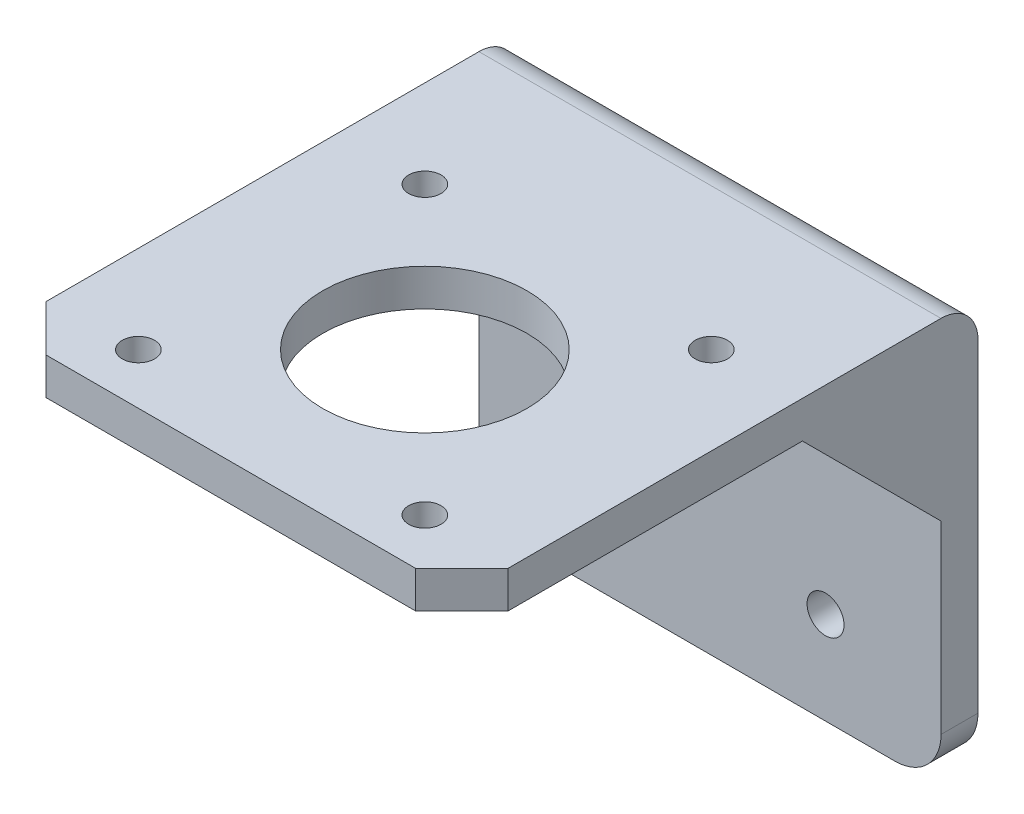
from build123d import *

# Parameters (mm, degrees)
SCHIZZO1_R                             = 1.75
SCHIZZO1_R_2                           = 11.05
SCHIZZO1_R_3                           = 2
BASE_FLANGIA1_DEPTH                    = 4
PIEGATURA_START                        = -3.5
PIEGATURA_DELLO_SCHIZZO1_OUTLINE_W     = 50
PIEGATURA_DELLO_SCHIZZO1_OUTLINE_H     = 4
PIEGATURA_DELLO_SCHIZZO1_DEPTH         = 51
PIEGATURA_START_2                      = -7.5
PIEGATURA_DELLO_SCHIZZO1_2_OUTLINE_R   = 1.75
PIEGATURA_DELLO_SCHIZZO1_2_OUTLINE_R_2 = 11.05
PIEGATURA_DELLO_SCHIZZO1_2_DEPTH       = 4
PIEGATURA_START_3                      = -26
PIEGATURA_DELLO_SCHIZZO1_3_DEPTH       = 52
PIEGATURA_START_4                      = -25
PIEGATURA_DELLO_SCHIZZO1_4_DEPTH       = 50
ESTRUSIONE_ESTRUSIONE1_DEPTH           = 2


with BuildPart() as part:
    # Base-Flangia1: sheet metal written as solids
    # Schizzo1 → Base-Flangia1 (new body)
    with BuildSketch(Plane.XY):
        with BuildLine():
            Line((-25, 42.5), (-20, 47.5))
            Line((-20, 47.5), (20, 47.5))
            Line((20, 47.5), (25, 42.5))
            Line((25, 42.5), (25, -42.5))
            ThreePointArc((25, -42.5), (23.535533906, -46.035533906), (20, -47.5))
            Line((20, -47.5), (-20, -47.5))
            ThreePointArc((-20, -47.5), (-23.535533906, -46.035533906), (-25, -42.5))
            Line((-25, -42.5), (-25, 42.5))
        make_face()
        with Locations((-15.5, 42)):
            Circle(SCHIZZO1_R, mode=Mode.SUBTRACT)
        with Locations((15.5, 42)):
            Circle(SCHIZZO1_R, mode=Mode.SUBTRACT)
        with Locations((15.5, 11)):
            Circle(SCHIZZO1_R, mode=Mode.SUBTRACT)
        with Locations((-15.5, 11)):
            Circle(SCHIZZO1_R, mode=Mode.SUBTRACT)
        with Locations((0, 26.5)):
            Circle(SCHIZZO1_R_2, mode=Mode.SUBTRACT)
        with Locations((-12.5, -37.5)):
            Circle(SCHIZZO1_R_3, mode=Mode.SUBTRACT)
        with Locations((12.5, -37.5)):
            Circle(SCHIZZO1_R_3, mode=Mode.SUBTRACT)
    extrude(amount=-BASE_FLANGIA1_DEPTH)

    # Piegatura dello schizzo1: read off the stored shape, not the designer's step
    # Piegatura dello schizzo1 outline → Piegatura dello schizzo1 (cut)
    with BuildSketch(Plane(origin=(0, 0, 0), x_dir=(1, 0, 0), z_dir=(0, 1, 0)).offset(PIEGATURA_START)):
        with Locations((0, 2)):
            Rectangle(PIEGATURA_DELLO_SCHIZZO1_OUTLINE_W, PIEGATURA_DELLO_SCHIZZO1_OUTLINE_H)
    extrude(amount=PIEGATURA_DELLO_SCHIZZO1_DEPTH, mode=Mode.SUBTRACT)

    # Piegatura dello schizzo1 2 outline → Piegatura dello schizzo1 2 (add)
    with BuildSketch(Plane(origin=(0, 0, 0), x_dir=(1, 0, 0), z_dir=(0, 1, 0)).offset(PIEGATURA_START_2)):
        Polygon((-25, 0), (-25, -46.862699383), (-20, -51.862699383), (20, -51.862699383), (25, -46.862699383), (25, 0), align=None)
        with Locations((-15.5, -46.362699383)):
            Circle(PIEGATURA_DELLO_SCHIZZO1_2_OUTLINE_R, mode=Mode.SUBTRACT)
        with Locations((15.5, -46.362699383)):
            Circle(PIEGATURA_DELLO_SCHIZZO1_2_OUTLINE_R, mode=Mode.SUBTRACT)
        with Locations((0, -30.862699383)):
            Circle(PIEGATURA_DELLO_SCHIZZO1_2_OUTLINE_R_2, mode=Mode.SUBTRACT)
        with Locations((-15.5, -15.362699383)):
            Circle(PIEGATURA_DELLO_SCHIZZO1_2_OUTLINE_R, mode=Mode.SUBTRACT)
        with Locations((15.5, -15.362699383)):
            Circle(PIEGATURA_DELLO_SCHIZZO1_2_OUTLINE_R, mode=Mode.SUBTRACT)
    extrude(amount=PIEGATURA_DELLO_SCHIZZO1_2_DEPTH)

    # Piegatura dello schizzo1 3 outline → Piegatura dello schizzo1 3 (cut)
    with BuildSketch(Plane.YZ.offset(PIEGATURA_START_3)):
        with BuildLine():
            ThreePointArc((-3.5, 0.01), (-4.674501807, -2.825498193), (-7.51, -4))
            Line((-7.51, -4), (-3.5, -4))
            Line((-3.5, -4), (-3.5, 0.01))
        make_face()
    extrude(amount=PIEGATURA_DELLO_SCHIZZO1_3_DEPTH, mode=Mode.SUBTRACT)

    # Piegatura dello schizzo1 4 outline → Piegatura dello schizzo1 4 (add)
    with BuildSketch(Plane.YZ.offset(PIEGATURA_START_4)):
        with BuildLine():
            ThreePointArc((-7.5, 0.01), (-7.502928932, 0.002928932), (-7.51, 0))
            Line((-7.51, 0), (-7.5, 0))
            Line((-7.5, 0), (-7.5, 0.01))
        make_face()
    extrude(amount=PIEGATURA_DELLO_SCHIZZO1_4_DEPTH)

    # Schizzo13 → Estrusione-Estrusione1 (add)
    with BuildSketch(Plane.ZY.offset(25)):
        with BuildLine():
            Line((0.01, -7.5), (15, -7.5))
            Line((15, -7.5), (0, -22.5))
            Line((0, -22.5), (0, -7.51))
            ThreePointArc((0, -7.51), (0.002928932, -7.502928932), (0.01, -7.5))
        make_face()
    estrusione_estrusione1 = extrude(amount=-ESTRUSIONE_ESTRUSIONE1_DEPTH)

    # Specchia1: Estrusione-Estrusione1 across plane
    add(estrusione_estrusione1.mirror(Plane(origin=(0, 0, 0), x_dir=(0, 0, 1), z_dir=(1, 0, 0))))


solid = part.part
